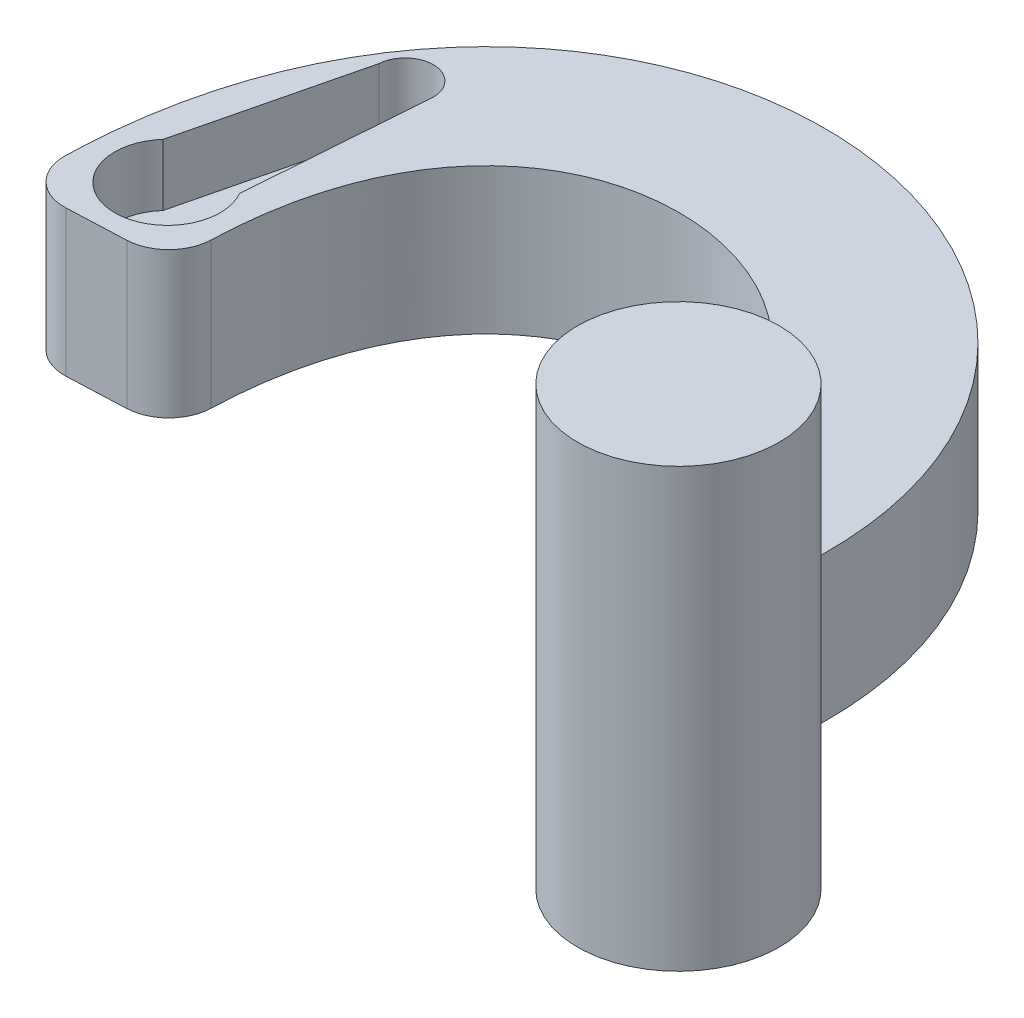
from build123d import *

# Parameters (mm, degrees)
EXTRUDE_THIN1_DEPTH = 10
SKETCH3_R           = 6.920707693
BOSS_EXTRUDE1_DEPTH = 10
BOSS_EXTRUDE3_START = -30
SKETCH6_R           = 6.920707693
BOSS_EXTRUDE3_DEPTH = 30
FILLET5_R           = 3
CUT_EXTRUDE2_DEPTH  = 4.2291
SKETCH8_R           = 1
CUT_EXTRUDE3_DEPTH  = 10


# Read off the part's stored shape, not the designer's step: Extrude-Thin1
with BuildPart() as part:
    # Extrude-Thin1 outline → Extrude-Thin1 (new body)
    with BuildSketch(Plane(origin=(0, 0, 0), x_dir=(1, 0, 0), z_dir=(0, 1, 0))):
        with BuildLine():
            Line((22.787644573, 16.321054497), (32.786727129, 16.185599595))
            add(Edge.make_bspline(
                [(32.786727129, 16.185599595), (32.811960434, 18.048285218), (32.641015725, 19.879615359), (31.92970267, 23.402358796), (31.389692113, 25.092847565), (29.996264529, 28.265553908), (29.143647795, 29.747564833), (27.19528421, 32.464868479), (26.100039873, 33.700572008), (23.728981302, 35.912471104), (22.453221171, 36.889166895), (19.767583781, 38.580346198), (18.357513706, 39.295168947), (15.436486932, 40.456738309), (13.925220488, 40.90365338), (10.829703301, 41.512793064), (9.245032555, 41.674991243), (6.03621689, 41.684984578), (4.411608755, 41.532400863), (1.175780595, 40.875380655), (-0.435544855, 40.370107305), (-3.562076247, 38.980716277), (-5.076448982, 38.095842257), (-7.905525663, 35.957656136), (-9.218857585, 34.704759204), (-11.55775534, 31.887270708), (-12.582900642, 30.324085176), (-14.305177479, 26.958999197), (-15.003087647, 25.157977385), (-16.072049137, 21.36655254), (-16.443959592, 19.376041131), (-16.874579144, 15.219557311), (-16.93365201, 13.053120971), (-16.839375878, 10.793799857)],
                knots=[0, 0, 0, 0, 0.0625, 0.0625, 0.125, 0.125, 0.1875, 0.1875, 0.25, 0.25, 0.3125, 0.3125, 0.375, 0.375, 0.4375, 0.4375, 0.5, 0.5, 0.5625, 0.5625, 0.625, 0.625, 0.6875, 0.6875, 0.75, 0.75, 0.8125, 0.8125, 0.875, 0.875, 0.9375, 0.9375, 1, 1, 1, 1], degree=3))
            Line((-16.839375878, 10.793799857), (-6.848070504, 11.210713427))
            add(Edge.make_bspline(
                [(22.787644573, 16.321054497), (23.040705887, 35.001670137), (-8.061946573, 40.30117097), (-6.848070504, 11.210713427)],
                knots=[0, 0, 0, 0, 1, 1, 1, 1], degree=3))
        make_face()
    extrude(amount=EXTRUDE_THIN1_DEPTH)

    # Sketch3 → Boss-Extrude1 (add)
    with BuildSketch(Plane.XZ):
        with Locations(Location((27.722370723, -11.46876918, 0), (0, 0, 317.034865558))):
            Circle(SKETCH3_R)
    extrude(amount=BOSS_EXTRUDE1_DEPTH)

    # Sketch6 → Boss-Extrude3 (add)
    with BuildSketch(Plane.XZ.offset(10).offset(BOSS_EXTRUDE3_START)):
        with Locations(Location((27.722370723, -11.46876918, 0), (0, 0, 270))):
            Circle(SKETCH6_R)
    extrude(amount=BOSS_EXTRUDE3_DEPTH)

    # Fillet5
    fillet5_edges = [part.edges().sort_by_distance(p)[0] for p in [
        (-6.848070504, 5, -11.210713427),
        (-16.839375878, 5, -10.793799857),
    ]]
    fillet(fillet5_edges, radius=FILLET5_R)

    # Sketch7 → Cut-Extrude2 (cut)
    with BuildSketch(Plane(origin=(0, 10, -10), x_dir=(1, 0, 0), z_dir=(0, -1, 0))):
        with BuildLine():
            Line((-8.649516125, -7.733026517), (-7.738756929, -19.897223008))
            ThreePointArc((-7.738756929, -19.897223008), (-9.492313797, -22.025587149), (-11.58447009, -20.228985455))
            Line((-11.58447009, -20.228985455), (-14.488068719, -8.331888199))
            ThreePointArc((-14.488068719, -8.331888199), (-12.154290458, -2.324192527), (-8.649516125, -7.733026517))
        make_face()
    extrude(amount=CUT_EXTRUDE2_DEPTH, mode=Mode.SUBTRACT)

    # Sketch8 → Cut-Extrude3 (cut)
    with BuildSketch(Plane(origin=(0, 5.7709, 0), x_dir=(1, 0, 0), z_dir=(0, 1, 0))):
        with Locations(Location((-11.784975147, 15.924801705, 0), (0, 0, 270))):
            Circle(SKETCH8_R)
    extrude(amount=-CUT_EXTRUDE3_DEPTH, mode=Mode.SUBTRACT)


solid = part.part
